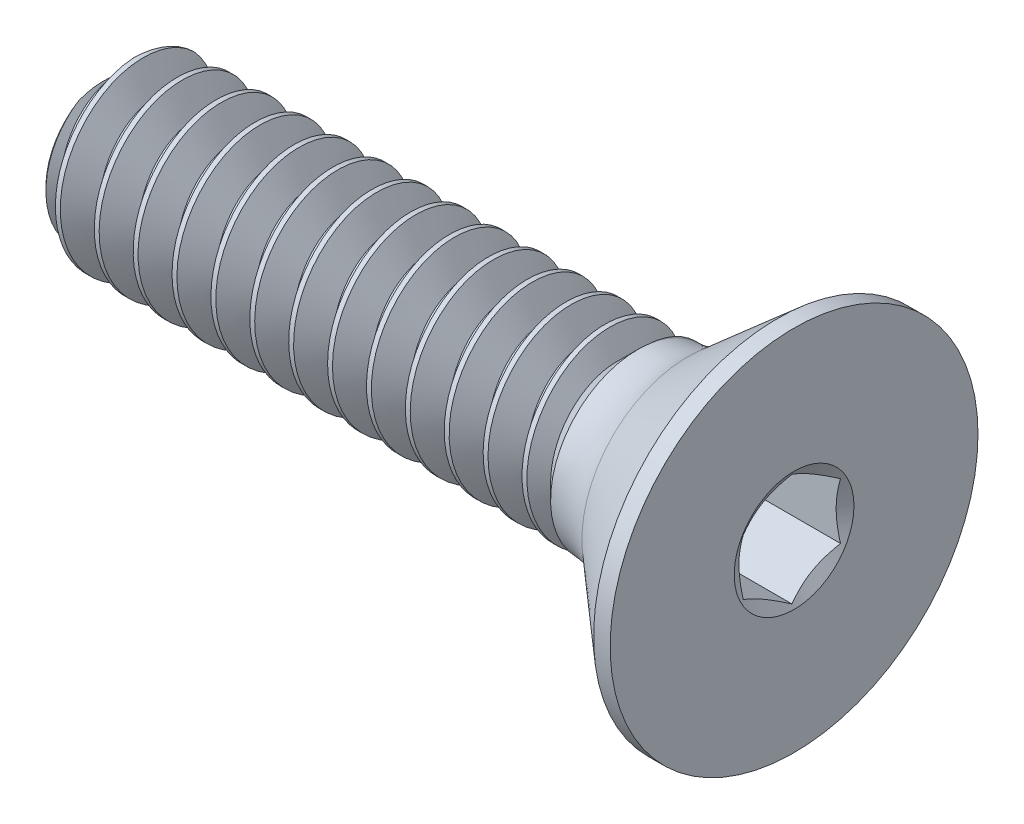
from build123d import *

# Parameters (mm, degrees)
CUT_EXTRUDE1_DEPTH = 1.397
DELETEFACE1_START  = 3
DELETEFACE1_DEPTH  = 1.15925
CUT_SWEEP1_PITCH   = 0.635
CUT_SWEEP1_TO      = 9.373948


with BuildPart() as part:
    # Sketch3 → Revolve1 (revolve)
    with BuildSketch(Plane.XY, mode=Mode.PRIVATE) as revolve1_sk:
        with BuildLine():
            Line((-5.23875, 1.4224), (-5.55625, 1.1049))
            Line((-5.55625, 1.1049), (-5.55625, 0))
            Line((-5.55625, 0), (5.55625, 0))
            Line((5.55625, 0), (5.55625, 3.00355))
            Line((5.55625, 3.00355), (5.285970943, 3.00355))
            Line((5.285970943, 3.00355), (3.817698226, 1.7272))
            ThreePointArc((3.817698226, 1.7272), (3.43764432, 1.501091686), (3.002473595, 1.4224))
            Line((3.002473595, 1.4224), (-5.23875, 1.4224))
        make_face()
    revolve(revolve1_sk.sketch.rotate(Axis((5.55625, 0, 0), (-1, 0, 0)), 90), axis=Axis((5.55625, 0, 0), (-1, 0, 0)))

    # Sketch4 → Cut-Extrude1 (cut)
    with BuildSketch(Plane(origin=(5.55625, 0, 0), x_dir=(0, 0, -1), z_dir=(1, 0, 0))):
        Polygon((0, 0.916543552), (-0.79375, 0.458271776), (-0.79375, -0.458271776), (0, -0.916543552), (0.79375, -0.458271776), (0.79375, 0.458271776), align=None)
    extrude(amount=-CUT_EXTRUDE1_DEPTH, mode=Mode.SUBTRACT)

    # Cut-Extrude2 cone 1 section (through the dimple's axis) → Cut-Extrude2 (revolve, cut)
    with BuildSketch(Plane(origin=(5.55625, 0, 0), x_dir=(0, 0, -1), z_dir=(0, 1, 0))):
        Polygon((0, 0), (0.977940329, 0), (0, 0.564614112), align=None)
    revolve(axis=Axis((5.55625, 0, 0), (-1, 0, 0)), mode=Mode.SUBTRACT)

    # Cut-Extrude3 cone 1 section (through the dimple's axis) → Cut-Extrude3 (revolve, cut)
    with BuildSketch(Plane(origin=(4.15925, 0, 0), x_dir=(0, 0, -1), z_dir=(0, 1, 0))):
        Polygon((0, 0), (0.79375, 0), (0, 0.458271776), align=None)
    revolve(axis=Axis((4.15925, 0, 0), (-1, 0, 0)), mode=Mode.SUBTRACT)

    # DeleteFace1: read off the stored shape, not the designer's step
    # DeleteFace1 outline → DeleteFace1 (add)
    with BuildSketch(Plane.YZ.offset(DELETEFACE1_START)):
        Polygon((-0.458271776, -0.79375), (0.458271776, -0.79375), (0.916543552, 0), (0.458271776, 0.79375), (-0.458271776, 0.79375), (-0.916543552, 0), align=None)
    extrude(amount=DELETEFACE1_DEPTH)


with BuildPart() as body_2:
    # Split1: the piece on the far side of the plane
    add(part.part)
    split(bisect_by=Plane(origin=(3.817698226, 0, 0), x_dir=(0, 0, 1), z_dir=(1, 0, 0)), keep=Keep.BOTTOM)

    # Cut-Sweep1: arcs per turn and ends read off the stored shape
    # Cut-Sweep1: the profile of Sketch7 screwed along a right-hand helix through 17.5 turns, 6 arcs to a turn; built about Z, then put on its axis
    cut_sweep1_z = Axis((0, 0, 0), (0, 0, 1))
    cut_sweep1_corners = [(1.009955401, 0, -0.3175), (1.456770383, 0, -0.57546875), (1.456770383, 0, 0.01984375), (1.009955401, 0, -0.238125)]
    with BuildLine(mode=Mode.PRIVATE) as cut_sweep1_profile:
        Line(cut_sweep1_corners[0], cut_sweep1_corners[1])
        Line(cut_sweep1_corners[1], cut_sweep1_corners[2])
        Line(cut_sweep1_corners[2], cut_sweep1_corners[3])
        Line(cut_sweep1_corners[3], cut_sweep1_corners[0])
    cut_sweep1_cap = Face(cut_sweep1_profile.wire())
    cut_sweep1_turn_angles = [0, 30, 60, 90, 120, 150, 180, 210, 240, 270, 300, 330, 360]
    cut_sweep1_turn_weights = [1, 0.8660254037844387, 1, 0.8660254037844387, 1, 0.8660254037844387, 1, 0.8660254037844387, 1, 0.8660254037844387, 1, 0.8660254037844387, 1]
    cut_sweep1_turn_rails = [Edge.make_bspline([Vector(p[0], p[1], 0).rotate(cut_sweep1_z, cut_sweep1_turn_angles[k]) / cut_sweep1_turn_weights[k] + Vector(0, 0, p[2] + CUT_SWEEP1_PITCH * cut_sweep1_turn_angles[k] / 360) for k in range(13)], [0, 0, 0, 1, 1, 2, 2, 3, 3, 4, 4, 5, 5, 6, 6, 6], 2, cut_sweep1_turn_weights) for p in cut_sweep1_corners]
    cut_sweep1_turn_sides = [Face.make_surface_from_curves(cut_sweep1_turn_rails[p[0]], cut_sweep1_turn_rails[p[1]]) for p in [(0, 1), (1, 2), (2, 3), (3, 0)]]
    cut_sweep1_last_angles = [6120, 6150, 6180, 6210, 6240, 6270, 6300]
    cut_sweep1_last_weights = [1, 0.8660254037844387, 1, 0.8660254037844387, 1, 0.8660254037844585, 1]
    cut_sweep1_last_rails = [Edge.make_bspline([Vector(p[0], p[1], 0).rotate(cut_sweep1_z, cut_sweep1_last_angles[k]) / cut_sweep1_last_weights[k] + Vector(0, 0, p[2] + CUT_SWEEP1_PITCH * cut_sweep1_last_angles[k] / 360) for k in range(7)], [0, 0, 0, 1, 1, 2, 2, 3, 3, 3], 2, cut_sweep1_last_weights) for p in cut_sweep1_corners]
    cut_sweep1_last_sides = [Face.make_surface_from_curves(cut_sweep1_last_rails[p[0]], cut_sweep1_last_rails[p[1]]) for p in [(0, 1), (1, 2), (2, 3), (3, 0)]]
    cut_sweep1 = Plane(origin=(-5.55625, 0, 0), x_dir=(0, -1, 0), z_dir=(1, 0, 0)) * split(Solid(Shell([*[p.moved(Location((0, 0, CUT_SWEEP1_PITCH * i))) for i in range(17) for p in cut_sweep1_turn_sides], *cut_sweep1_last_sides, cut_sweep1_cap, cut_sweep1_cap.rotate(cut_sweep1_z, 6300).moved(Location((0, 0, CUT_SWEEP1_PITCH * 6300 / 360)))])), bisect_by=Plane.XY.offset(CUT_SWEEP1_TO), keep=Keep.BOTTOM, mode=Mode.PRIVATE)
    add(cut_sweep1, mode=Mode.SUBTRACT)


with BuildPart() as part_1:
    add(part.part)

    # Split1
    split(bisect_by=Plane(origin=(3.817698226, 0, 0), x_dir=(0, 0, 1), z_dir=(1, 0, 0)), keep=Keep.TOP)

    add(body_2.part)  # Revolve2 merges body 2
    # Sketch9 → Revolve2 (revolve)
    with BuildSketch(Plane.XY, mode=Mode.PRIVATE) as revolve2_sk:
        with BuildLine():
            Line((3.002473595, 1.4224), (3.002473595, 0))
            Line((3.002473595, 0), (3.817698226, 0))
            Line((3.817698226, 0), (3.817698226, 1.7272))
            ThreePointArc((3.817698226, 1.7272), (3.43764432, 1.501091686), (3.002473595, 1.4224))
        make_face()
    revolve(revolve2_sk.sketch.rotate(Axis((3.002473595, 0, 0), (1, 0, 0)), 270), axis=Axis((3.002473595, 0, 0), (1, 0, 0)))

    # Cut-Extrude4 cone 1 section (through the dimple's axis) → Cut-Extrude4 (revolve, cut)
    with BuildSketch(Plane(origin=(4.15925, 0, 0), x_dir=(0, 0, -1), z_dir=(0, 1, 0))):
        Polygon((0, 0), (0.79375, 0), (0, 0.458271776), align=None)
    revolve(axis=Axis((4.15925, 0, 0), (-1, 0, 0)), mode=Mode.SUBTRACT)

    # Boss-Extrude1: read off the stored shape, not the designer's step
    # Boss-Extrude1 outline → Boss-Extrude1 (revolve)
    with BuildSketch(Plane.YX):
        Polygon((1.009952804, 3.002473595), (1.009952804, 2.590026399), (1.4224, 3.002473595), align=None)
    revolve(axis=Axis((0, 0, 0), (1, 0, 0)))


solid = part_1.part
